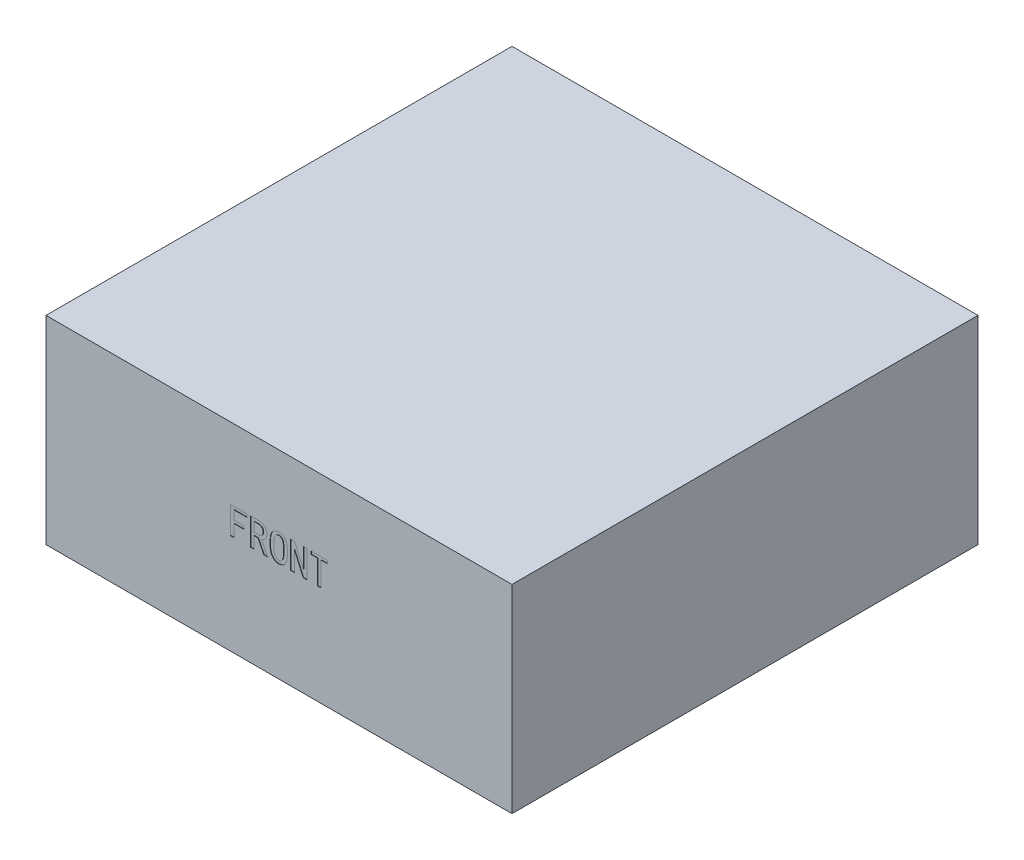
from build123d import *

# Parameters (mm, degrees)
SKETCH1_W           = 115
SKETCH1_H           = 115
BOSS_EXTRUDE1_DEPTH = 49
CUT_EXTRUDE1_DEPTH  = 0.1
SKETCH3_R           = 1.5
CUT_EXTRUDE2_DEPTH  = 10


with BuildPart() as part:
    # Sketch1 → Boss-Extrude1 (new body)
    with BuildSketch(Plane(origin=(0, 0, 0), x_dir=(1, 0, 0), z_dir=(0, 1, 0))):
        Rectangle(SKETCH1_W, SKETCH1_H)
    extrude(amount=BOSS_EXTRUDE1_DEPTH)

    # Sketch2 → Cut-Extrude1 (cut)
    # profile 1 of 5: a face of its own
    with BuildSketch(Plane.XY.offset(57.5)):
        Polygon((-7.917836765, 30.623647153), (-11.116174769, 30.623647153), (-11.116174769, 28.439416321), (-8.697919205, 28.439416321), (-8.697919205, 27.698338004), (-11.116174769, 27.698338004), (-11.116174769, 24.69502061), (-12.013269574, 24.69502061), (-12.013269574, 31.364725471), (-7.917836765, 31.364725471), align=None)
    # profile 2 of 5: a face of its own
    with BuildSketch(Plane.XY.offset(57.5)):
        with BuildLine():
            Line((-2.808296784, 24.69502061), (-3.744395712, 24.69502061))
            Line((-3.744395712, 24.69502061), (-5.148544103, 27.581325638))
            Line((-5.148544103, 27.581325638), (-6.162651275, 27.581325638))
            Line((-6.162651275, 27.581325638), (-6.162651275, 24.69502061))
            Line((-6.162651275, 24.69502061), (-7.059746081, 24.69502061))
            Line((-7.059746081, 24.69502061), (-7.059746081, 31.364725471))
            Line((-7.059746081, 31.364725471), (-5.109539981, 31.364725471))
            add(Edge.make_bspline(
                [(-5.109539981, 31.364725471), (-5.033422241, 31.36321552), (-4.884283624, 31.36025705), (-4.665846358, 31.340727494), (-4.45885424, 31.304160913), (-4.262886168, 31.2548471), (-4.076887368, 31.193875661), (-3.903169293, 31.114522393), (-3.739054577, 31.023957299), (-3.586622204, 30.918577266), (-3.448652055, 30.797520978), (-3.327861252, 30.658008975), (-3.227422926, 30.499867995), (-3.143874152, 30.324418369), (-3.081593847, 30.131289285), (-3.03483742, 29.921040893), (-3.007693079, 29.693076761), (-3.004805189, 29.534974999), (-3.003317394, 29.453523493)],
                knots=[0, 0, 0, 0, 1.124851401, 2.203938021, 3.236923468, 4.227547377, 5.188384515, 6.124748074, 7.04535131, 7.955333121, 8.85768773, 9.750678987, 10.67246398, 11.61778816, 12.61462837, 13.664292026, 14.796680505, 16, 16, 16, 16], degree=3))
            add(Edge.make_bspline(
                [(-3.003317394, 29.453523493), (-3.004236594, 29.390390165), (-3.006030237, 29.267197519), (-3.025454571, 29.088095913), (-3.055313469, 28.91994093), (-3.097086791, 28.762601258), (-3.151593342, 28.616101913), (-3.220384865, 28.48106626), (-3.299426456, 28.356037186), (-3.420653553, 28.207891531), (-3.588089734, 28.047546476), (-3.806690348, 27.888834669), (-4.041069396, 27.768553012), (-4.20761293, 27.721662055), (-4.290453419, 27.698338004)],
                knots=[0, 0, 0, 0, 0.960252019, 1.873748618, 2.737466876, 3.556786617, 4.347431233, 5.110891588, 5.858830743, 6.593445102, 8.018399741, 9.372640647, 10.693124067, 12, 12, 12, 12], degree=3))
            Line((-4.290453419, 27.698338004), (-2.808296784, 24.69502061))
        make_face()
        with BuildLine():
            add(Edge.make_bspline(
                [(-3.900412199, 29.453523493), (-3.901748926, 29.49785105), (-3.904356853, 29.584333232), (-3.918058807, 29.710781951), (-3.944676192, 29.829563943), (-3.979689395, 29.941648265), (-4.029204658, 30.044568137), (-4.084168454, 30.142579968), (-4.154012978, 30.230821503), (-4.23149366, 30.314063254), (-4.321756192, 30.387946189), (-4.424347653, 30.452561636), (-4.540300007, 30.505247189), (-4.66873106, 30.548395909), (-4.809255351, 30.583172975), (-4.962947559, 30.607131703), (-5.129478007, 30.621721067), (-5.24481863, 30.622989931), (-5.304560591, 30.623647153)],
                knots=[0, 0, 0, 0, 1.018423225, 1.986923476, 2.915383729, 3.810714658, 4.676600435, 5.533969095, 6.385612358, 7.253966558, 8.141821118, 9.056210967, 10.031005151, 11.059229177, 12.164336364, 13.351610032, 14.628236891, 16, 16, 16, 16], degree=3))
            Line((-5.304560591, 30.623647153), (-6.162651275, 30.623647153))
            Line((-6.162651275, 30.623647153), (-6.162651275, 28.322403955))
            Line((-6.162651275, 28.322403955), (-5.070535859, 28.322403955))
            add(Edge.make_bspline(
                [(-5.070535859, 28.322403955), (-4.994665596, 28.325278445), (-4.846167618, 28.330904573), (-4.631700963, 28.380266995), (-4.431452215, 28.459145684), (-4.278021472, 28.551076939), (-4.166997245, 28.642292798), (-4.09583809, 28.724884044), (-4.034438276, 28.817808807), (-3.985709894, 28.923304629), (-3.946407327, 29.039415745), (-3.919439908, 29.167412302), (-3.903806651, 29.306747081), (-3.901571336, 29.403402305), (-3.900412199, 29.453523493)],
                knots=[0, 0, 0, 0, 1.47184772, 2.880791526, 4.249240139, 5.638178403, 6.335067569, 7.030952029, 7.746845966, 8.491482783, 9.28109559, 10.123026367, 11.02668324, 12, 12, 12, 12], degree=3))
        make_face(mode=Mode.SUBTRACT)
    # profile 3 of 5: a face of its own
    with BuildSketch(Plane.XY.offset(57.5)):
        with BuildLine():
            add(Edge.make_bspline(
                [(2.106222588, 28.049375102), (2.104638402, 27.901989899), (2.10158126, 27.617567687), (2.076095619, 27.207161265), (2.031695072, 26.82904424), (1.970403688, 26.482896179), (1.891842386, 26.168709294), (1.795828911, 25.886167353), (1.680457686, 25.636023899), (1.546904644, 25.41693972), (1.39678476, 25.227882136), (1.233894982, 25.063918506), (1.056291438, 24.92550274), (0.864707416, 24.811956665), (0.658556134, 24.724615825), (0.438710496, 24.662734024), (0.204547172, 24.624299596), (0.043488517, 24.619480605), (-0.039004122, 24.617012366)],
                knots=[0, 0, 0, 0, 1.545836505, 2.983136913, 4.310657039, 5.537175887, 6.667851947, 7.704493515, 8.662599122, 9.55136463, 10.389079191, 11.189082316, 11.970061338, 12.744463405, 13.518420627, 14.311409556, 15.135120791, 16, 16, 16, 16], degree=3))
            add(Edge.make_bspline(
                [(-0.039004122, 24.617012366), (-0.121500553, 24.619461841), (-0.282566612, 24.624244198), (-0.517594069, 24.663091696), (-0.739347562, 24.724661311), (-0.94821304, 24.811465061), (-1.141829149, 24.926310641), (-1.323405374, 25.063670898), (-1.490622201, 25.227714829), (-1.644998894, 25.416745077), (-1.783350279, 25.635389631), (-1.900892003, 25.886353937), (-2.002130368, 26.168221542), (-2.083356965, 26.482676242), (-2.145811299, 26.8290056), (-2.191653976, 27.207114767), (-2.218999451, 27.617515704), (-2.22178939, 27.901982841), (-2.223234954, 28.049375102)],
                knots=[0, 0, 0, 0, 0.860715957, 1.680462108, 2.47930714, 3.258798976, 4.033804958, 4.822976692, 5.629862064, 6.472991471, 7.365455267, 8.323231869, 9.359903903, 10.487649235, 11.709164083, 13.030896221, 14.461604659, 16, 16, 16, 16], degree=3))
            add(Edge.make_bspline(
                [(-2.223234954, 28.049375102), (-2.221797055, 28.196767253), (-2.219026596, 28.480753675), (-2.19168221, 28.890200387), (-2.145741574, 29.266845166), (-2.083787264, 29.610896124), (-2.001917575, 29.922344351), (-1.900792728, 30.200819234), (-1.784188051, 30.448592174), (-1.644441558, 30.662080248), (-1.49068342, 30.846771475), (-1.322820459, 31.006235125), (-1.141824641, 31.140922798), (-0.947714733, 31.252374573), (-0.739333592, 31.338201692), (-0.517347932, 31.397603951), (-0.282639025, 31.43742263), (-0.121517361, 31.440934979), (-0.039004122, 31.442733715)],
                knots=[0, 0, 0, 0, 1.548230922, 2.98303917, 4.308200808, 5.532550635, 6.652834833, 7.686623778, 8.641401291, 9.522543054, 10.35935634, 11.160886009, 11.949022642, 12.72391454, 13.50644669, 14.309045162, 15.13403228, 16, 16, 16, 16], degree=3))
            add(Edge.make_bspline(
                [(-0.039004122, 31.442733715), (0.043505595, 31.440916879), (0.204620382, 31.437369185), (0.438460465, 31.397958442), (0.65854017, 31.338245657), (0.864214402, 31.251892228), (1.05626943, 31.141722698), (1.233314852, 31.006005274), (1.396849483, 30.846601498), (1.546358274, 30.661899939), (1.68129518, 30.447931356), (1.79572828, 30.201010175), (1.891641604, 29.921856448), (1.970823367, 29.61066893), (2.031627706, 29.26680742), (2.076122742, 28.890153344), (2.10160703, 28.480701525), (2.104645443, 28.196760167), (2.106222588, 28.049375102)],
                knots=[0, 0, 0, 0, 0.870222972, 1.699263968, 2.496006616, 3.272995294, 4.047285334, 4.827112443, 5.621581463, 6.452817072, 7.330064346, 8.285160362, 9.318904812, 10.442120126, 11.67157227, 13.002634169, 14.444161275, 16, 16, 16, 16], degree=3))
        make_face()
        with BuildLine():
            add(Edge.make_bspline(
                [(1.17012366, 28.049375102), (1.168977278, 28.179886743), (1.166785118, 28.429456735), (1.151419283, 28.786062711), (1.124868433, 29.10767027), (1.086021701, 29.394031602), (1.038724051, 29.646003408), (0.978466823, 29.862111581), (0.909424785, 30.044151489), (0.825355184, 30.191731443), (0.732569272, 30.312395299), (0.638213496, 30.416827035), (0.53757346, 30.505020013), (0.431191022, 30.575712746), (0.32142593, 30.63363454), (0.205145093, 30.672042098), (0.08497742, 30.698401397), (0.002551737, 30.700564728), (-0.039004122, 30.701655397)],
                knots=[0, 0, 0, 0, 1.935009416, 3.700208474, 5.290966952, 6.717666284, 7.983429577, 9.088666043, 10.040575683, 10.86236036, 11.596304304, 12.29363804, 12.946461271, 13.574167208, 14.184039162, 14.780089417, 15.384968011, 16, 16, 16, 16], degree=3))
            add(Edge.make_bspline(
                [(-0.039004122, 30.701655397), (-0.080555875, 30.70053613), (-0.163446064, 30.698303341), (-0.284570281, 30.672034759), (-0.402300825, 30.633687961), (-0.513806475, 30.575437521), (-0.622819585, 30.504672225), (-0.727847858, 30.417593743), (-0.824785822, 30.311539897), (-0.923924964, 30.192680435), (-1.011907116, 30.044393297), (-1.085946133, 29.862679926), (-1.148438959, 29.646084929), (-1.199253455, 29.394281784), (-1.23892723, 29.107683237), (-1.267027351, 28.786105392), (-1.284203339, 28.429491941), (-1.286129065, 28.179891142), (-1.287136026, 28.049375102)],
                knots=[0, 0, 0, 0, 0.611089153, 1.219041108, 1.817987105, 2.430269109, 3.065779911, 3.730623558, 4.433151476, 5.17984647, 6.00710797, 6.960941472, 8.063026251, 9.323472721, 10.742001662, 12.323182839, 14.077395506, 16, 16, 16, 16], degree=3))
            add(Edge.make_bspline(
                [(-1.287136026, 28.049375102), (-1.286119055, 27.918859607), (-1.284170438, 27.668778862), (-1.267050694, 27.311199198), (-1.238787588, 26.987718066), (-1.199388023, 26.699166508), (-1.148324152, 26.444988861), (-1.085265087, 26.225327663), (-1.012248341, 26.038947749), (-0.923791362, 25.886167259), (-0.825317626, 25.762772497), (-0.727367115, 25.653945286), (-0.623352213, 25.562417879), (-0.514212634, 25.488577227), (-0.402328492, 25.429191077), (-0.284857724, 25.388690247), (-0.163359034, 25.363366086), (-0.08053703, 25.359852599), (-0.039004122, 25.358090684)],
                knots=[0, 0, 0, 0, 1.904974992, 3.650122658, 5.223805484, 6.643247296, 7.899019683, 9.004487743, 9.975563022, 10.813390195, 11.569780086, 12.276151917, 12.948593274, 13.586073969, 14.195949674, 14.79168842, 15.394065703, 16, 16, 16, 16], degree=3))
            add(Edge.make_bspline(
                [(-0.039004122, 25.358090684), (0.00253254, 25.359825142), (0.084889905, 25.363264162), (0.205435569, 25.388686474), (0.321452346, 25.429245854), (0.431609339, 25.488302788), (0.538123441, 25.562087821), (0.637704368, 25.654694156), (0.733123672, 25.761945098), (0.825192901, 25.887101393), (0.9097528, 26.039195265), (0.977804575, 26.225863601), (1.038614333, 26.445069857), (1.086149637, 26.699416093), (1.124733858, 26.987729887), (1.151442396, 27.311241785), (1.166754233, 27.668813837), (1.168968136, 27.918863952), (1.17012366, 28.049375102)],
                knots=[0, 0, 0, 0, 0.609746698, 1.208983301, 1.801799102, 2.40924424, 3.039088536, 3.699939805, 4.401261932, 5.145395336, 5.978015425, 6.947413619, 8.055962864, 9.316862112, 10.744271275, 12.327239227, 14.08303934, 16, 16, 16, 16], degree=3))
        make_face(mode=Mode.SUBTRACT)
    # profile 4 of 5: a face of its own
    with BuildSketch(Plane.XY.offset(57.5)):
        Polygon((6.942733715, 24.69502061), (5.967630665, 24.69502061), (3.822403955, 29.531531737), (3.783399833, 29.531531737), (3.783399833, 24.69502061), (2.886305028, 24.69502061), (2.886305028, 31.364725471), (3.861408077, 31.364725471), (6.006634787, 26.528214344), (6.045638909, 26.528214344), (6.045638909, 31.364725471), (6.942733715, 31.364725471), align=None)
    # profile 5 of 5: a face of its own
    with BuildSketch(Plane.XY.offset(57.5)):
        Polygon((11.93526133, 30.623647153), (10.375096451, 30.623647153), (10.375096451, 24.69502061), (9.478001645, 24.69502061), (9.478001645, 30.623647153), (7.917836765, 30.623647153), (7.917836765, 31.364725471), (11.93526133, 31.364725471), align=None)
    extrude(amount=-CUT_EXTRUDE1_DEPTH, mode=Mode.SUBTRACT)

    # Sketch3 → Cut-Extrude2 (cut)
    with BuildSketch(Plane.XZ):
        with Locations((-15, 42.5)):
            Circle(SKETCH3_R)
        with Locations((-15, -42.5)):
            Circle(SKETCH3_R)
    extrude(amount=-CUT_EXTRUDE2_DEPTH, mode=Mode.SUBTRACT)


solid = part.part
